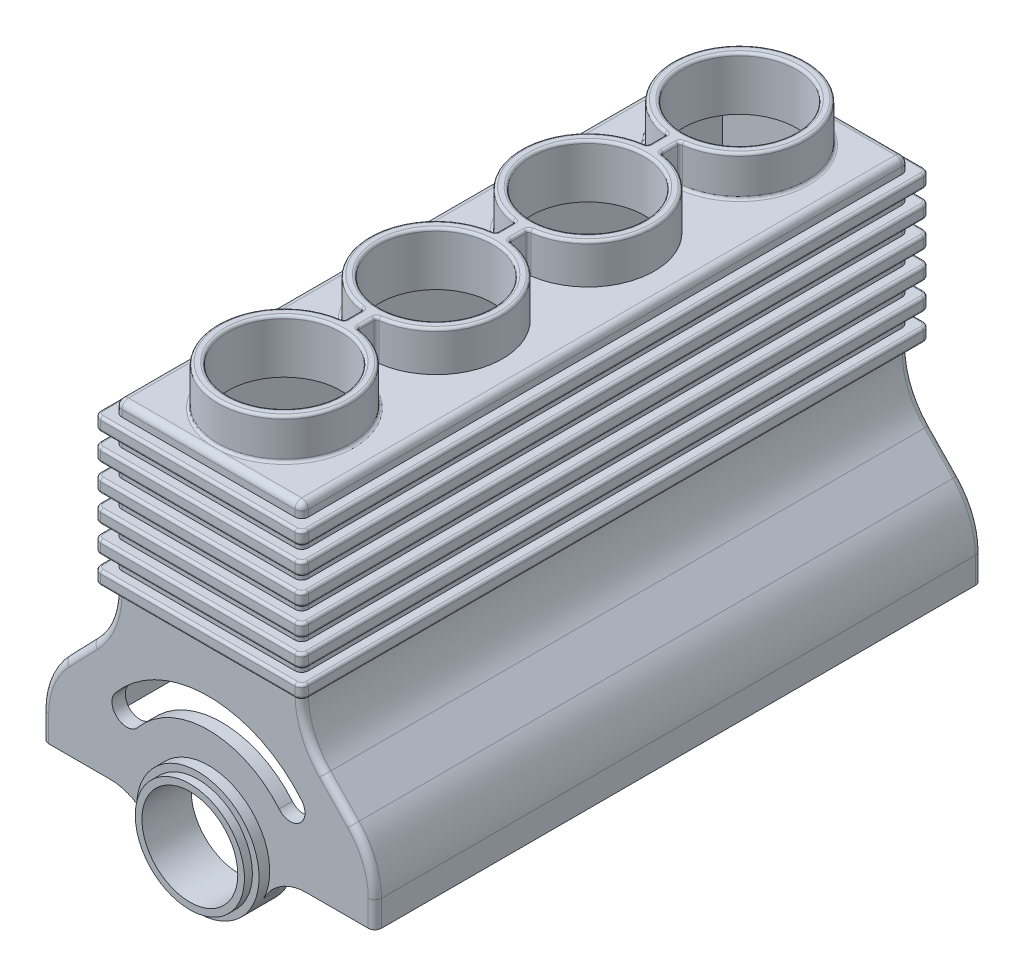
from build123d import *
from build123d.topology import SkipClean

# Parameters (mm, degrees)
BOSS_EXTRUDE1_DEPTH     = 228
FILLET1_R               = 5
SHELL1_T                = -10
BOSS_EXTRUDE2_DEPTH     = 10
FILLET2_R               = 2
LPATTERN1_COUNT         = 6
LPATTERN1_PITCH         = 20
FILLET2_OF_LPATTERN1_R  = 2
BOSS_EXTRUDE3_OUTLINE_R = 42.5
BOSS_EXTRUDE3_DEPTH     = 30
CUT_EXTRUDE1_START      = -60
SKETCH3_4_R             = 42.5
CUT_EXTRUDE1_DEPTH      = 60
FILLET3_R               = 2
BOSS_EXTRUDE4_START     = -23
BOSS_EXTRUDE4_DEPTH     = 37
BOSS_EXTRUDE5_START     = -18
BOSS_EXTRUDE5_DEPTH     = 26
CUT_EXTRUDE2_REACH      = 558.166
BOSS_EXTRUDE6_START     = -10
BOSS_EXTRUDE6_DEPTH     = 10


# Read off the part's stored shape, not the designer's step: Boss-Extrude3
with BuildPart() as part:
    # Sketch1 → Boss-Extrude1 (new, symmetric)
    with BuildSketch(Plane.XY):
        with BuildLine():
            Line((-36, 0), (-125, 0))
            Line((-125, 0), (-125, 19.562685641))
            ThreePointArc((-125, 19.562685641), (-120.631031274, 42.039081246), (-108.16038802, 61.242187869))
            Line((-108.16038802, 61.242187869), (-86.83961198, 83.320497772))
            ThreePointArc((-86.83961198, 83.320497772), (-74.368968726, 102.523604395), (-70, 125))
            Line((-70, 125), (-70, 250))
            Line((-70, 250), (70, 250))
            Line((70, 250), (70, 125))
            ThreePointArc((70, 125), (74.368968726, 102.523604395), (86.83961198, 83.320497772))
            Line((86.83961198, 83.320497772), (108.16038802, 61.242187869))
            ThreePointArc((108.16038802, 61.242187869), (120.631031274, 42.039081246), (125, 19.562685641))
            Line((125, 19.562685641), (125, 0))
            Line((125, 0), (36, 0))
            ThreePointArc((36, 0), (0, 36), (-36, 0))
        make_face()
    extrude(amount=BOSS_EXTRUDE1_DEPTH, both=True)

    # Fillet1
    fillet1_edges = [part.edges().sort_by_distance(p)[0] for p in [
        (125, 9.781342821, -228),
        (-125, 9.781342821, 228),
        (-120.631031274, 42.039081246, 228),
        (-97.5, 72.281342821, 228),
        (-74.368968726, 102.523604395, 228),
        (-70, 187.5, 228),
        (0, 250, 228),
        (70, 187.5, 228),
        (120.631031274, 42.039081246, -228),
        (74.368968726, 102.523604395, 228),
        (97.5, 72.281342821, 228),
        (120.631031274, 42.039081246, 228),
        (125, 9.781342821, 228),
        (97.5, 72.281342821, -228),
        (-70, 250, 0),
        (70, 250, 0),
        (74.368968726, 102.523604395, -228),
        (70, 187.5, -228),
        (0, 250, -228),
        (-70, 187.5, -228),
        (-74.368968726, 102.523604395, -228),
        (-97.5, 72.281342821, -228),
        (-120.631031274, 42.039081246, -228),
        (-125, 9.781342821, -228),
    ]]
    fillet(fillet1_edges, radius=FILLET1_R)

    # Shell1
    shell1_openings = [part.faces().sort_by_distance(p)[0] for p in [
        (-80.488526799, 0, 0),
        (80.488526799, 0, 0),
        (0, 36, 0),
    ]]
    offset(amount=SHELL1_T, openings=shell1_openings)

    # Sketch2 → Boss-Extrude2 (add)
    with BuildSketch(Plane(origin=(0, 240, 0), x_dir=(1, 0, 0), z_dir=(0, 1, 0))):
        with BuildLine():
            Line((-73, 236), (73, 236))
            ThreePointArc((73, 236), (76.535533906, 234.535533906), (78, 231))
            Line((78, 231), (78, -231))
            ThreePointArc((78, -231), (76.535533906, -234.535533906), (73, -236))
            Line((73, -236), (-73, -236))
            ThreePointArc((-73, -236), (-76.535533906, -234.535533906), (-78, -231))
            Line((-78, -231), (-78, 231))
            ThreePointArc((-78, 231), (-76.535533906, 234.535533906), (-73, 236))
        make_face()
        with BuildLine():
            Line((70, 223), (70, -223))
            ThreePointArc((70, -223), (68.535533906, -226.535533906), (65, -228))
            Line((65, -228), (-65, -228))
            ThreePointArc((-65, -228), (-68.535533906, -226.535533906), (-70, -223))
            Line((-70, -223), (-70, 223))
            ThreePointArc((-70, 223), (-68.535533906, 226.535533906), (-65, 228))
            Line((-65, 228), (65, 228))
            ThreePointArc((65, 228), (68.535533906, 226.535533906), (70, 223))
        make_face(mode=Mode.SUBTRACT)
    boss_extrude2 = extrude(amount=-BOSS_EXTRUDE2_DEPTH)

    # Fillet2
    fillet2_edges = [part.edges().sort_by_distance(p)[0] for p in [
        (76.535533906, 230, -234.535533906),
        (78, 230, 0),
        (76.535533906, 230, 234.535533906),
        (0, 230, 236),
        (-76.535533906, 230, 234.535533906),
        (-78, 230, 0),
        (-76.535533906, 230, -234.535533906),
        (0, 230, -236),
        (76.535533906, 240, -234.535533906),
        (0, 240, -236),
        (-76.535533906, 240, -234.535533906),
        (-78, 240, 0),
        (-76.535533906, 240, 234.535533906),
        (0, 240, 236),
        (76.535533906, 240, 234.535533906),
        (78, 240, 0),
    ]]
    fillet(fillet2_edges, radius=FILLET2_R)

    # LPattern1: Boss-Extrude2 ×6
    with Locations(*[(0, -i * LPATTERN1_PITCH, 0) for i in range(1, LPATTERN1_COUNT)]):
        add(boss_extrude2)

    # Fillet2 of LPattern1
    fillet2_of_lpattern1_edges = [part.edges().sort_by_distance(p)[0] for p in [
        (76.535533906, 210, -234.535533906),
        (78, 210, 0),
        (76.535533906, 210, 234.535533906),
        (0, 210, 236),
        (-76.535533906, 210, 234.535533906),
        (-78, 210, 0),
        (-76.535533906, 210, -234.535533906),
        (0, 210, -236),
        (76.535533906, 220, -234.535533906),
        (0, 220, -236),
        (-76.535533906, 220, -234.535533906),
        (-78, 220, 0),
        (-76.535533906, 220, 234.535533906),
        (0, 220, 236),
        (76.535533906, 220, 234.535533906),
        (78, 220, 0),
        (76.535533906, 190, -234.535533906),
        (78, 190, 0),
        (76.535533906, 190, 234.535533906),
        (0, 190, 236),
        (-76.535533906, 190, 234.535533906),
        (-78, 190, 0),
        (-76.535533906, 190, -234.535533906),
        (0, 190, -236),
        (76.535533906, 200, -234.535533906),
        (0, 200, -236),
        (-76.535533906, 200, -234.535533906),
        (-78, 200, 0),
        (-76.535533906, 200, 234.535533906),
        (0, 200, 236),
        (76.535533906, 200, 234.535533906),
        (78, 200, 0),
        (76.535533906, 170, -234.535533906),
        (78, 170, 0),
        (76.535533906, 170, 234.535533906),
        (0, 170, 236),
        (-76.535533906, 170, 234.535533906),
        (-78, 170, 0),
        (-76.535533906, 170, -234.535533906),
        (0, 170, -236),
        (76.535533906, 180, -234.535533906),
        (0, 180, -236),
        (-76.535533906, 180, -234.535533906),
        (-78, 180, 0),
        (-76.535533906, 180, 234.535533906),
        (0, 180, 236),
        (76.535533906, 180, 234.535533906),
        (78, 180, 0),
        (76.535533906, 150, -234.535533906),
        (78, 150, 0),
        (76.535533906, 150, 234.535533906),
        (0, 150, 236),
        (-76.535533906, 150, 234.535533906),
        (-78, 150, 0),
        (-76.535533906, 150, -234.535533906),
        (0, 150, -236),
        (76.535533906, 160, -234.535533906),
        (0, 160, -236),
        (-76.535533906, 160, -234.535533906),
        (-78, 160, 0),
        (-76.535533906, 160, 234.535533906),
        (0, 160, 236),
        (76.535533906, 160, 234.535533906),
        (78, 160, 0),
        (76.535533906, 130, -234.535533906),
        (78, 130, 0),
        (76.535533906, 130, 234.535533906),
        (0, 130, 236),
        (-76.535533906, 130, 234.535533906),
        (-78, 130, 0),
        (-76.535533906, 130, -234.535533906),
        (0, 130, -236),
        (76.535533906, 140, -234.535533906),
        (0, 140, -236),
        (-76.535533906, 140, -234.535533906),
        (-78, 140, 0),
        (-76.535533906, 140, 234.535533906),
        (0, 140, 236),
        (76.535533906, 140, 234.535533906),
        (78, 140, 0),
    ]]
    fillet(fillet2_of_lpattern1_edges, radius=FILLET2_OF_LPATTERN1_R)

    # Boss-Extrude3 outline → Boss-Extrude3 (add)
    with BuildSketch(Plane(origin=(0, 250, 0), x_dir=(1, 0, 0), z_dir=(0, 1, 0))):
        with BuildLine():
            ThreePointArc((-5, -121.250628145), (0, -221), (5, -121.250628145))
            Line((5, -121.250628145), (5, -106.749371855))
            ThreePointArc((5, -106.749371855), (50, -57), (5, -7.250628145))
            Line((5, -7.250628145), (5, 7.250628145))
            ThreePointArc((5, 7.250628145), (50, 57), (5, 106.749371855))
            Line((5, 106.749371855), (5, 121.250628145))
            ThreePointArc((5, 121.250628145), (0, 221), (-5, 121.250628145))
            Line((-5, 121.250628145), (-5, 106.749371855))
            ThreePointArc((-5, 106.749371855), (-50, 57), (-5, 7.250628145))
            Line((-5, 7.250628145), (-5, -7.250628145))
            ThreePointArc((-5, -7.250628145), (-50, -57), (-5, -106.749371855))
            Line((-5, -106.749371855), (-5, -121.250628145))
        make_face()
        with Locations((0, -171)):
            Circle(BOSS_EXTRUDE3_OUTLINE_R, mode=Mode.SUBTRACT)
        with Locations((0, -57)):
            Circle(BOSS_EXTRUDE3_OUTLINE_R, mode=Mode.SUBTRACT)
        with Locations((0, 57)):
            Circle(BOSS_EXTRUDE3_OUTLINE_R, mode=Mode.SUBTRACT)
        with Locations((0, 171)):
            Circle(BOSS_EXTRUDE3_OUTLINE_R, mode=Mode.SUBTRACT)
    extrude(amount=BOSS_EXTRUDE3_DEPTH)

    # Sketch3<4> → Cut-Extrude1 (cut)
    with BuildSketch(Plane(origin=(0, 250, 0), x_dir=(1, 0, 0), z_dir=(0, 1, 0)).offset(CUT_EXTRUDE1_START)):
        with BuildLine():
            ThreePointArc((42.5, -57), (30.0520382, -26.9479618), (0, -14.5))
            Line((0, -14.5), (0, -99.5))
            ThreePointArc((0, -99.5), (30.0520382, -87.0520382), (42.5, -57))
        make_face()
        with BuildLine():
            Line((0, -99.5), (0, -14.5))
            ThreePointArc((0, -14.5), (-42.5, -57), (0, -99.5))
        make_face()
        with BuildLine():
            ThreePointArc((42.5, -57), (30.0520382, -26.9479618), (0, -14.5))
            Line((0, -14.5), (0, -99.5))
            ThreePointArc((0, -99.5), (30.0520382, -87.0520382), (42.5, -57))
        make_face()
        with BuildLine():
            Line((0, -99.5), (0, -14.5))
            ThreePointArc((0, -14.5), (-42.5, -57), (0, -99.5))
        make_face()
        with BuildLine():
            ThreePointArc((42.5, -171), (30.0520382, -140.9479618), (0, -128.5))
            Line((0, -128.5), (0, -213.5))
            ThreePointArc((0, -213.5), (30.0520382, -201.0520382), (42.5, -171))
        make_face()
        with BuildLine():
            Line((0, -213.5), (0, -128.5))
            ThreePointArc((0, -128.5), (-42.5, -171), (0, -213.5))
        make_face()
        with BuildLine():
            ThreePointArc((42.5, -171), (30.0520382, -140.9479618), (0, -128.5))
            Line((0, -128.5), (0, -213.5))
            ThreePointArc((0, -213.5), (30.0520382, -201.0520382), (42.5, -171))
        make_face()
        with BuildLine():
            Line((0, -213.5), (0, -128.5))
            ThreePointArc((0, -128.5), (-42.5, -171), (0, -213.5))
        make_face()
        with Locations(Location((0, 57, 0), (0, 0, 270))):
            Circle(SKETCH3_4_R)
        with Locations(Location((0, 171, 0), (0, 0, 270))):
            Circle(SKETCH3_4_R)
    extrude(amount=CUT_EXTRUDE1_DEPTH, mode=Mode.SUBTRACT)

    # Fillet3
    fillet3_edges = [part.edges().sort_by_distance(p)[0] for p in [
        (0, 250, 221),
        (-50, 250, 57),
        (-50, 250, -57),
        (0, 250, -221),
        (-5, 265, -121.250628145),
        (-5, 265, -106.749371855),
        (-5, 250, -114),
        (-5, 265, -7.250628145),
        (-5, 265, 7.250628145),
        (-5, 250, 0),
        (-5, 265, 106.749371855),
        (-5, 265, 121.250628145),
        (-5, 250, 114),
        (5, 265, 121.250628145),
        (5, 265, 106.749371855),
        (5, 250, 114),
        (5, 265, 7.250628145),
        (5, 265, -7.250628145),
        (5, 250, 0),
        (5, 265, -106.749371855),
        (5, 265, -121.250628145),
        (5, 250, -114),
        (-5, 280, 114),
        (-50, 280, 57),
        (-5, 280, 0),
        (-50, 280, -57),
        (-5, 280, -114),
        (0, 280, -221),
        (5, 280, -114),
        (50, 280, -57),
        (5, 280, 0),
        (50, 280, 57),
        (5, 280, 114),
        (0, 280, 221),
        (-42.5, 280, 171),
        (-42.5, 280, 57),
        (-42.5, 280, -57),
        (-42.5, 280, -171),
    ]]
    fillet(fillet3_edges, radius=FILLET3_R - 0.0001)  # a hair under: the kernel refuses the full size

    # Sketch4 → Boss-Extrude4 (add)
    with BuildSketch(Plane(origin=(0, 0, -228), x_dir=(-1, 0, 0), z_dir=(0, 0, -1)).offset(BOSS_EXTRUDE4_START)):
        with BuildLine():
            Line((36, 0), (41, 0))
            ThreePointArc((41, 0), (0, 41), (-41, 0))
            Line((-41, 0), (-36, 0))
            ThreePointArc((-36, 0), (0, 36), (36, 0))
        make_face()
        with BuildLine():
            ThreePointArc((-41, 0), (0, -41), (41, 0))
            Line((41, 0), (36, 0))
            ThreePointArc((36, 0), (0, -36), (-36, 0))
            Line((-36, 0), (-41, 0))
        make_face()
        with BuildLine():
            Line((36, 0), (41, 0))
            ThreePointArc((41, 0), (0, 41), (-41, 0))
            Line((-41, 0), (-36, 0))
            ThreePointArc((-36, 0), (0, 36), (36, 0))
        make_face()
    boss_extrude4 = extrude(amount=BOSS_EXTRUDE4_DEPTH)

    # Sketch4<3> → Boss-Extrude5 (add)
    with BuildSketch(Plane(origin=(0, 0, -228), x_dir=(-1, 0, 0), z_dir=(0, 0, -1)).offset(BOSS_EXTRUDE5_START)):
        with BuildLine():
            Line((41, 0), (46, 0))
            ThreePointArc((46, 0), (0, 46), (-46, 0))
            Line((-46, 0), (-41, 0))
            ThreePointArc((-41, 0), (0, 41), (41, 0))
        make_face()
        with BuildLine():
            ThreePointArc((-46, 0), (0, -46), (46, 0))
            Line((46, 0), (41, 0))
            ThreePointArc((41, 0), (0, -41), (-41, 0))
            Line((-41, 0), (-46, 0))
        make_face()
        with BuildLine():
            Line((41, 0), (46, 0))
            ThreePointArc((46, 0), (0, 46), (-46, 0))
            Line((-46, 0), (-41, 0))
            ThreePointArc((-41, 0), (0, 41), (41, 0))
        make_face()
        with BuildLine():
            ThreePointArc((-46, 0), (0, -46), (46, 0))
            Line((46, 0), (41, 0))
            ThreePointArc((41, 0), (0, -41), (-41, 0))
            Line((-41, 0), (-46, 0))
        make_face()
    boss_extrude5 = extrude(amount=BOSS_EXTRUDE5_DEPTH)

    # Sketch5 → Cut-Extrude2 (cut, up to next)
    with BuildSketch(Plane(origin=(0, 0, -228), x_dir=(-1, 0, 0), z_dir=(0, 0, -1)), mode=Mode.PRIVATE) as cut_extrude2_sk1:
        with BuildLine():
            ThreePointArc((69.95625, 58.198995575), (0, 91), (-69.95625, 58.198995575))
            ThreePointArc((-69.95625, 58.198995575), (-68.535043421, 42.707702154), (-53.04375, 44.128908733))
            ThreePointArc((-53.04375, 44.128908733), (0, 69), (53.04375, 44.128908733))
            ThreePointArc((53.04375, 44.128908733), (68.535043421, 42.707702154), (69.95625, 58.198995575))
        make_face()
    cut_extrude2_tool1 = extrude(cut_extrude2_sk1.sketch, amount=-CUT_EXTRUDE2_REACH, mode=Mode.PRIVATE) & part.part
    cut_extrude2 = cut_extrude2_tool1.solids().sort_by_distance((-67.552355, 43.888911, -228))[0]
    add(cut_extrude2, mode=Mode.SUBTRACT)

    # Sketch5<3> → Boss-Extrude6 (add)
    with BuildSketch(Plane(origin=(0, 0, -228), x_dir=(-1, 0, 0), z_dir=(0, 0, -1)).offset(BOSS_EXTRUDE6_START)):
        with BuildLine():
            ThreePointArc((41.329856634, -20.195121951), (54.608966045, -5.46333671), (73.674961826, 0))
            Line((73.674961826, 0), (46, 0))
            ThreePointArc((46, 0), (44.817258981, -10.364038664), (41.329856634, -20.195121951))
        make_face()
        with BuildLine():
            ThreePointArc((-73.674961826, 0), (-54.608966045, -5.46333671), (-41.329856634, -20.195121951))
            ThreePointArc((-41.329856634, -20.195121951), (-44.817258981, -10.364038664), (-46, 0))
            Line((-46, 0), (-73.674961826, 0))
        make_face()
    boss_extrude6 = extrude(amount=BOSS_EXTRUDE6_DEPTH)

    # Mirror1: Boss-Extrude4, Boss-Extrude5, Cut-Extrude2, Boss-Extrude6 across plane
    with SkipClean():  # the faces are left unmerged after this step: merging them gives an invalid solid
        add(boss_extrude4.mirror(Plane.XY))
        add(boss_extrude5.mirror(Plane.XY))
        add(cut_extrude2.mirror(Plane.XY), mode=Mode.SUBTRACT)
        add(boss_extrude6.mirror(Plane.XY))


solid = part.part
